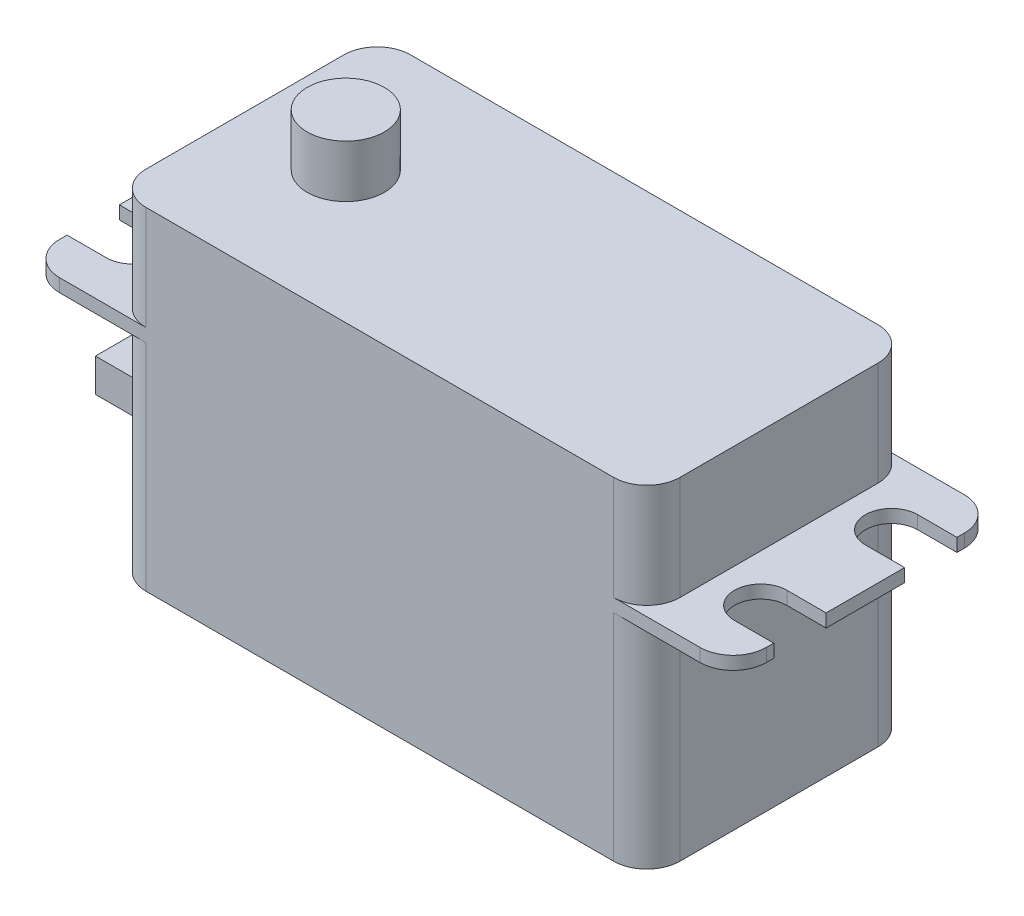
from build123d import *

# Parameters (mm, degrees)
BOSS_EXTRUDE1_DEPTH = 1
BOSS_EXTRUDE2_DEPTH = 7.95
BOSS_EXTRUDE3_START = 16.45
BOSS_EXTRUDE3_DEPTH = 16.45
SKETCH5_W           = 7.62
SKETCH5_H           = 2.54
SKETCH5_W_2         = 1.768524962
SKETCH5_H_2         = 1.697224475
BOSS_EXTRUDE4_DEPTH = 7.62
SKETCH6_R           = 2.95
BOSS_EXTRUDE5_DEPTH = 4


with BuildPart() as part:
    # Sketch1 → Boss-Extrude1 (new body)
    with BuildSketch(Plane(origin=(0, 0, 0), x_dir=(1, 0, 0), z_dir=(0, 1, 0))):
        with BuildLine():
            ThreePointArc((-27, -7.56), (-26.256051224, -9.356051224), (-24.46, -10.1))
            Line((-24.46, -10.1), (24.46, -10.1))
            ThreePointArc((24.46, -10.1), (26.256051224, -9.356051224), (27, -7.56))
            Line((27, -7.56), (27, -7))
            Line((27, -7), (24, -7))
            ThreePointArc((24, -7), (22, -5), (24, -3))
            Line((24, -3), (27, -3))
            Line((27, -3), (27, 3))
            Line((27, 3), (24, 3))
            ThreePointArc((24, 3), (22, 5), (24, 7))
            Line((24, 7), (27, 7))
            Line((27, 7), (27, 7.56))
            ThreePointArc((27, 7.56), (26.256051224, 9.356051224), (24.46, 10.1))
            Line((24.46, 10.1), (-24.46, 10.1))
            ThreePointArc((-24.46, 10.1), (-26.256051224, 9.356051224), (-27, 7.56))
            Line((-27, 7.56), (-27, 7))
            Line((-27, 7), (-24, 7))
            ThreePointArc((-24, 7), (-22, 5), (-24, 3))
            Line((-24, 3), (-27, 3))
            Line((-27, 3), (-27, -3))
            Line((-27, -3), (-24, -3))
            ThreePointArc((-24, -3), (-22, -5), (-24, -7))
            Line((-24, -7), (-27, -7))
            Line((-27, -7), (-27, -7.56))
        make_face()
    extrude(amount=BOSS_EXTRUDE1_DEPTH)

    # Sketch3 → Boss-Extrude2 (add)
    with BuildSketch(Plane(origin=(0, 1, 0), x_dir=(1, 0, 0), z_dir=(0, 1, 0))):
        with BuildLine():
            Line((-17.86, -10.1), (17.86, -10.1))
            ThreePointArc((17.86, -10.1), (19.656051224, -9.356051224), (20.4, -7.56))
            Line((20.4, -7.56), (20.4, 7.56))
            ThreePointArc((20.4, 7.56), (19.656051224, 9.356051224), (17.86, 10.1))
            Line((17.86, 10.1), (-17.86, 10.1))
            ThreePointArc((-17.86, 10.1), (-19.656051224, 9.356051224), (-20.4, 7.56))
            Line((-20.4, 7.56), (-20.4, -7.56))
            ThreePointArc((-20.4, -7.56), (-19.656051224, -9.356051224), (-17.86, -10.1))
        make_face()
    extrude(amount=BOSS_EXTRUDE2_DEPTH)

    # Sketch4 → Boss-Extrude3 (add)
    with BuildSketch(Plane.XZ.offset(BOSS_EXTRUDE3_START)):
        with BuildLine():
            Line((-17.86, -10.1), (17.86, -10.1))
            ThreePointArc((17.86, -10.1), (19.656051224, -9.356051224), (20.4, -7.56))
            Line((20.4, -7.56), (20.4, 7.56))
            ThreePointArc((20.4, 7.56), (19.656051224, 9.356051224), (17.86, 10.1))
            Line((17.86, 10.1), (-17.86, 10.1))
            ThreePointArc((-17.86, 10.1), (-19.656051224, 9.356051224), (-20.4, 7.56))
            Line((-20.4, 7.56), (-20.4, -7.56))
            ThreePointArc((-20.4, -7.56), (-19.656051224, -9.356051224), (-17.86, -10.1))
        make_face()
    extrude(amount=-BOSS_EXTRUDE3_DEPTH)

    # Sketch5 → Boss-Extrude4 (add)
    with BuildSketch(Plane.ZY.offset(20.4)):
        with Locations((0, -10.377289394)):
            Rectangle(SKETCH5_W, SKETCH5_H)
        with Locations((0, -10.377289394)):
            Rectangle(SKETCH5_W_2, SKETCH5_H_2, mode=Mode.SUBTRACT)
        with Locations((-2.54, -10.377289394)):
            Rectangle(SKETCH5_W_2, SKETCH5_H_2, mode=Mode.SUBTRACT)
        with Locations((2.54, -10.377289394)):
            Rectangle(SKETCH5_W_2, SKETCH5_H_2, mode=Mode.SUBTRACT)
    extrude(amount=BOSS_EXTRUDE4_DEPTH)

    # Sketch6 → Boss-Extrude5 (add)
    with BuildSketch(Plane(origin=(0, 8.95, 0), x_dir=(1, 0, 0), z_dir=(0, 1, 0))):
        with Locations((-12.7, 0)):
            Circle(SKETCH6_R)
    extrude(amount=BOSS_EXTRUDE5_DEPTH)


solid = part.part
